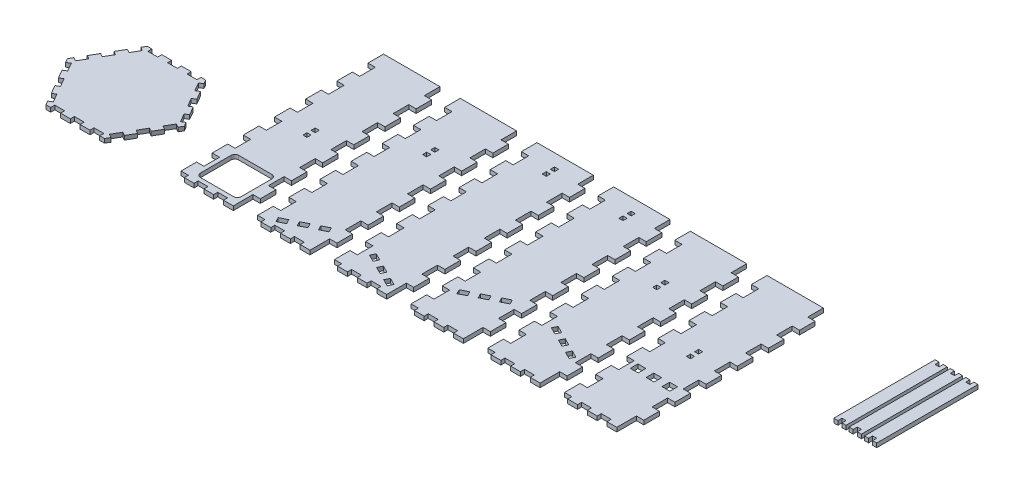
from build123d import *

# Parameters (mm, degrees)
BOSS_EXTRUDE3_DEPTH    = 3.2
SKETCH1_W              = 3.2
SKETCH1_H              = 3.2
BOSS_EXTRUDE3_2_DEPTH  = 3.2
BOSS_EXTRUDE3_3_DEPTH  = 3.2
BOSS_EXTRUDE3_4_DEPTH  = 3.2
BOSS_EXTRUDE3_5_DEPTH  = 3.2
BOSS_EXTRUDE3_6_DEPTH  = 3.2
SKETCH1_W_2            = 6.2
SKETCH1_H_2            = 6
BOSS_EXTRUDE3_7_DEPTH  = 3.2
BOSS_EXTRUDE3_8_DEPTH  = 3.2
BOSS_EXTRUDE3_9_DEPTH  = 3.2
BOSS_EXTRUDE3_10_DEPTH = 3.2


with BuildPart() as part:
    # Sketch1 → Boss-Extrude3 (new body)
    with BuildSketch(Plane(origin=(0, 0, 0), x_dir=(1, 0, 0), z_dir=(0, 1, 0))):
        Polygon((-22.869998863, -39.612), (-19.17495714, -39.612), (-19.17495714, -36.412), (-11.504974284, -36.412), (-11.504974284, -39.612), (-3.834991428, -39.612), (-3.834991428, -36.412), (3.834991428, -36.412), (3.834991428, -39.612), (11.504974284, -39.612), (11.504974284, -36.412), (19.17495714, -36.412), (19.17495714, -39.612), (22.869998863, -39.612), (24.717519725, -36.412), (21.946238432, -34.812), (25.781229861, -28.1696), (28.552511153, -29.7696), (32.387502581, -23.1272), (29.616221289, -21.5272), (33.451212717, -14.8848), (36.222494009, -16.4848), (40.057485437, -9.8424), (37.286204145, -8.2424), (41.121195573, -1.6), (43.892476865, -3.2), (45.739997726, 0), (43.892476865, 3.2), (41.121195573, 1.6), (37.286204145, 8.2424), (40.057485437, 9.8424), (36.222494009, 16.4848), (33.451212717, 14.8848), (29.616221289, 21.5272), (32.387502581, 23.1272), (28.552511153, 29.7696), (25.781229861, 28.1696), (21.946238432, 34.812), (24.717519725, 36.412), (22.869998863, 39.612), (19.17495714, 39.612), (19.17495714, 36.412), (11.504974284, 36.412), (11.504974284, 39.612), (3.834991428, 39.612), (3.834991428, 36.412), (-3.834991428, 36.412), (-3.834991428, 39.612), (-11.504974284, 39.612), (-11.504974284, 36.412), (-19.17495714, 36.412), (-19.17495714, 39.612), (-22.869998863, 39.612), (-24.717519725, 36.412), (-21.946238432, 34.812), (-25.781229861, 28.1696), (-28.552511153, 29.7696), (-32.387502581, 23.1272), (-29.616221289, 21.5272), (-33.451212717, 14.8848), (-36.222494009, 16.4848), (-40.057485437, 9.8424), (-37.286204145, 8.2424), (-41.121195573, 1.6), (-43.892476865, 3.2), (-45.739997726, 0), (-43.892476865, -3.2), (-41.121195573, -1.6), (-37.286204145, -8.2424), (-40.057485437, -9.8424), (-36.222494009, -16.4848), (-33.451212717, -14.8848), (-29.616221289, -21.5272), (-32.387502581, -23.1272), (-28.552511153, -29.7696), (-25.781229861, -28.1696), (-21.946238432, -34.812), (-24.717519725, -36.412), align=None)
    extrude(amount=BOSS_EXTRUDE3_DEPTH)


with BuildPart() as body_2:
    # Sketch1 → Boss-Extrude3 2 (new body)
    with BuildSketch(Plane(origin=(0, 0, 0), x_dir=(1, 0, 0), z_dir=(0, 1, 0))):
        Polygon((80.552757397, -34.879378177), (88.222740254, -34.879378177), (88.222740254, -31.679378177), (95.89272311, -31.679378177), (95.89272311, -34.879378177), (103.562705966, -34.879378177), (103.562705966, -31.679378177), (111.232688822, -31.679378177), (111.232688822, -34.879378177), (118.902671678, -34.879378177), (118.902671678, -19.491070485), (124.645234262, -19.491070485), (124.645234262, -7.302762793), (118.902671678, -7.302762793), (118.902671678, 4.8855449), (124.645234262, 4.8855449), (124.645234262, 17.073852592), (118.902671678, 17.073852592), (118.902671678, 29.262160284), (124.645234262, 29.262160284), (124.645234262, 41.450467977), (118.902671678, 41.450467977), (118.902671678, 53.638775669), (124.645234262, 53.638775669), (124.645234262, 65.827083361), (118.902671678, 65.827083361), (118.902671678, 78.015391054), (124.645234262, 78.015391054), (124.645234262, 90.203698746), (118.902671678, 90.203698746), (118.902671678, 102.392006438), (124.645234262, 102.392006438), (124.645234262, 114.58031413), (118.902671678, 114.58031413), (118.902671678, 126.768621823), (74.810194813, 126.768621823), (74.810194813, 114.58031413), (80.552757397, 114.58031413), (80.552757397, 102.392006438), (74.810194813, 102.392006438), (74.810194813, 90.203698746), (80.552757397, 90.203698746), (80.552757397, 78.015391054), (74.810194813, 78.015391054), (74.810194813, 65.827083361), (80.552757397, 65.827083361), (80.552757397, 53.638775669), (74.810194813, 53.638775669), (74.810194813, 41.450467977), (80.552757397, 41.450467977), (80.552757397, 29.262160284), (74.810194813, 29.262160284), (74.810194813, 17.073852592), (80.552757397, 17.073852592), (80.552757397, 4.8855449), (74.810194813, 4.8855449), (74.810194813, -7.302762793), (80.552757397, -7.302762793), (80.552757397, -19.491070485), (74.810194813, -19.491070485), (74.810194813, -31.679378177), (80.552757397, -31.679378177), align=None)
        with BuildLine():
            Line((86.752757397, 1.520621823), (112.702671678, 1.520621823))
            ThreePointArc((112.702671678, 1.520621823), (114.823992022, 0.641942166), (115.702671678, -1.479378177))
            Line((115.702671678, -1.479378177), (115.702671678, -25.479378177))
            ThreePointArc((115.702671678, -25.479378177), (114.823992022, -27.600698521), (112.702671678, -28.479378177))
            Line((112.702671678, -28.479378177), (86.752757397, -28.479378177))
            ThreePointArc((86.752757397, -28.479378177), (84.631437054, -27.600698521), (83.752757397, -25.479378177))
            Line((83.752757397, -25.479378177), (83.752757397, -1.479378177))
            ThreePointArc((83.752757397, -1.479378177), (84.631437054, 0.641942166), (86.752757397, 1.520621823))
        make_face(mode=Mode.SUBTRACT)
        with Locations((99.727714538, 41.960621823)):
            Rectangle(SKETCH1_W, SKETCH1_H, mode=Mode.SUBTRACT)
        with Locations((99.727714538, 48.360621823)):
            Rectangle(SKETCH1_W, SKETCH1_H, mode=Mode.SUBTRACT)
    extrude(amount=BOSS_EXTRUDE3_2_DEPTH)


with BuildPart() as body_3:
    # Sketch1 → Boss-Extrude3 3 (new body)
    with BuildSketch(Plane(origin=(0, 0, 0), x_dir=(1, 0, 0), z_dir=(0, 1, 0))):
        Polygon((140.552757397, -34.879378177), (148.222740254, -34.879378177), (148.222740254, -31.679378177), (155.89272311, -31.679378177), (155.89272311, -34.879378177), (163.562705966, -34.879378177), (163.562705966, -31.679378177), (171.232688822, -31.679378177), (171.232688822, -34.879378177), (178.902671678, -34.879378177), (178.902671678, -19.491070485), (184.645234262, -19.491070485), (184.645234262, -7.302762793), (178.902671678, -7.302762793), (178.902671678, 4.8855449), (184.645234262, 4.8855449), (184.645234262, 17.073852592), (178.902671678, 17.073852592), (178.902671678, 29.262160284), (184.645234262, 29.262160284), (184.645234262, 41.450467977), (178.902671678, 41.450467977), (178.902671678, 53.638775669), (184.645234262, 53.638775669), (184.645234262, 65.827083361), (178.902671678, 65.827083361), (178.902671678, 78.015391054), (184.645234262, 78.015391054), (184.645234262, 90.203698746), (178.902671678, 90.203698746), (178.902671678, 102.392006438), (184.645234262, 102.392006438), (184.645234262, 114.58031413), (178.902671678, 114.58031413), (178.902671678, 126.768621823), (134.810194813, 126.768621823), (134.810194813, 114.58031413), (140.552757397, 114.58031413), (140.552757397, 102.392006438), (134.810194813, 102.392006438), (134.810194813, 90.203698746), (140.552757397, 90.203698746), (140.552757397, 78.015391054), (134.810194813, 78.015391054), (134.810194813, 65.827083361), (140.552757397, 65.827083361), (140.552757397, 53.638775669), (134.810194813, 53.638775669), (134.810194813, 41.450467977), (140.552757397, 41.450467977), (140.552757397, 29.262160284), (134.810194813, 29.262160284), (134.810194813, 17.073852592), (140.552757397, 17.073852592), (140.552757397, 4.8855449), (134.810194813, 4.8855449), (134.810194813, -7.302762793), (140.552757397, -7.302762793), (140.552757397, -19.491070485), (134.810194813, -19.491070485), (134.810194813, -31.679378177), (140.552757397, -31.679378177), align=None)
        Polygon((144.432637465, -25.240025921), (149.978339593, -22.467808774), (151.766866785, -26.045681115), (146.221164657, -28.817898262), align=None, mode=Mode.SUBTRACT)
        Polygon((155.524041721, -19.695591627), (161.069743848, -16.92337448), (162.85827104, -20.50124682), (157.312568912, -23.273463967), align=None, mode=Mode.SUBTRACT)
        Polygon((166.615445976, -14.151157333), (172.161148104, -11.378940185), (173.949675295, -14.956812526), (168.403973168, -17.729029673), align=None, mode=Mode.SUBTRACT)
        with Locations((159.727714538, 75.560621823)):
            Rectangle(SKETCH1_W, SKETCH1_H, mode=Mode.SUBTRACT)
        with Locations((159.727714538, 81.960621823)):
            Rectangle(SKETCH1_W, SKETCH1_H, mode=Mode.SUBTRACT)
    extrude(amount=BOSS_EXTRUDE3_3_DEPTH)


with BuildPart() as body_4:
    # Sketch1 → Boss-Extrude3 4 (new body)
    with BuildSketch(Plane(origin=(0, 0, 0), x_dir=(1, 0, 0), z_dir=(0, 1, 0))):
        Polygon((200.552757397, -34.879378177), (208.222740254, -34.879378177), (208.222740254, -31.679378177), (215.89272311, -31.679378177), (215.89272311, -34.879378177), (223.562705966, -34.879378177), (223.562705966, -31.679378177), (231.232688822, -31.679378177), (231.232688822, -34.879378177), (238.902671678, -34.879378177), (238.902671678, -19.491070485), (244.645234262, -19.491070485), (244.645234262, -7.302762793), (238.902671678, -7.302762793), (238.902671678, 4.8855449), (244.645234262, 4.8855449), (244.645234262, 17.073852592), (238.902671678, 17.073852592), (238.902671678, 29.262160284), (244.645234262, 29.262160284), (244.645234262, 41.450467977), (238.902671678, 41.450467977), (238.902671678, 53.638775669), (244.645234262, 53.638775669), (244.645234262, 65.827083361), (238.902671678, 65.827083361), (238.902671678, 78.015391054), (244.645234262, 78.015391054), (244.645234262, 90.203698746), (238.902671678, 90.203698746), (238.902671678, 102.392006438), (244.645234262, 102.392006438), (244.645234262, 114.58031413), (238.902671678, 114.58031413), (238.902671678, 126.768621823), (194.810194813, 126.768621823), (194.810194813, 114.58031413), (200.552757397, 114.58031413), (200.552757397, 102.392006438), (194.810194813, 102.392006438), (194.810194813, 90.203698746), (200.552757397, 90.203698746), (200.552757397, 78.015391054), (194.810194813, 78.015391054), (194.810194813, 65.827083361), (200.552757397, 65.827083361), (200.552757397, 53.638775669), (194.810194813, 53.638775669), (194.810194813, 41.450467977), (200.552757397, 41.450467977), (200.552757397, 29.262160284), (194.810194813, 29.262160284), (194.810194813, 17.073852592), (200.552757397, 17.073852592), (200.552757397, 4.8855449), (194.810194813, 4.8855449), (194.810194813, -7.302762793), (200.552757397, -7.302762793), (200.552757397, -19.491070485), (194.810194813, -19.491070485), (194.810194813, -31.679378177), (200.552757397, -31.679378177), align=None)
        Polygon((207.294280972, -11.378940185), (205.50575378, -14.956812526), (211.051455908, -17.729029673), (212.8399831, -14.151157333), align=None, mode=Mode.SUBTRACT)
        Polygon((218.385685227, -16.92337448), (216.597158036, -20.50124682), (222.142860163, -23.273463967), (223.931387355, -19.695591627), align=None, mode=Mode.SUBTRACT)
        Polygon((229.477089483, -22.467808774), (227.688562291, -26.045681115), (233.234264419, -28.817898262), (235.02279161, -25.240025921), align=None, mode=Mode.SUBTRACT)
        with Locations((219.727714538, 109.160621823)):
            Rectangle(SKETCH1_W, SKETCH1_H, mode=Mode.SUBTRACT)
        with Locations((219.727714538, 115.560621823)):
            Rectangle(SKETCH1_W, SKETCH1_H, mode=Mode.SUBTRACT)
    extrude(amount=BOSS_EXTRUDE3_4_DEPTH)


with BuildPart() as body_5:
    # Sketch1 → Boss-Extrude3 5 (new body)
    with BuildSketch(Plane(origin=(0, 0, 0), x_dir=(1, 0, 0), z_dir=(0, 1, 0))):
        Polygon((260.552757397, -34.879378177), (268.222740254, -34.879378177), (268.222740254, -31.679378177), (275.89272311, -31.679378177), (275.89272311, -34.879378177), (283.562705966, -34.879378177), (283.562705966, -31.679378177), (291.232688822, -31.679378177), (291.232688822, -34.879378177), (298.902671678, -34.879378177), (298.902671678, -19.491070485), (304.645234262, -19.491070485), (304.645234262, -7.302762793), (298.902671678, -7.302762793), (298.902671678, 4.8855449), (304.645234262, 4.8855449), (304.645234262, 17.073852592), (298.902671678, 17.073852592), (298.902671678, 29.262160284), (304.645234262, 29.262160284), (304.645234262, 41.450467977), (298.902671678, 41.450467977), (298.902671678, 53.638775669), (304.645234262, 53.638775669), (304.645234262, 65.827083361), (298.902671678, 65.827083361), (298.902671678, 78.015391054), (304.645234262, 78.015391054), (304.645234262, 90.203698746), (298.902671678, 90.203698746), (298.902671678, 102.392006438), (304.645234262, 102.392006438), (304.645234262, 114.58031413), (298.902671678, 114.58031413), (298.902671678, 126.768621823), (254.810194813, 126.768621823), (254.810194813, 114.58031413), (260.552757397, 114.58031413), (260.552757397, 102.392006438), (254.810194813, 102.392006438), (254.810194813, 90.203698746), (260.552757397, 90.203698746), (260.552757397, 78.015391054), (254.810194813, 78.015391054), (254.810194813, 65.827083361), (260.552757397, 65.827083361), (260.552757397, 53.638775669), (254.810194813, 53.638775669), (254.810194813, 41.450467977), (260.552757397, 41.450467977), (260.552757397, 29.262160284), (254.810194813, 29.262160284), (254.810194813, 17.073852592), (260.552757397, 17.073852592), (260.552757397, 4.8855449), (254.810194813, 4.8855449), (254.810194813, -7.302762793), (260.552757397, -7.302762793), (260.552757397, -19.491070485), (254.810194813, -19.491070485), (254.810194813, -31.679378177), (260.552757397, -31.679378177), align=None)
        Polygon((265.863459219, -6.902455299), (264.074932027, -3.324582959), (269.620634155, -0.552365811), (271.409161346, -4.130238152), align=None, mode=Mode.SUBTRACT)
        Polygon((275.166336282, 2.219851336), (276.954863474, -1.358021005), (282.500565602, 1.414196143), (280.71203841, 4.992068483), align=None, mode=Mode.SUBTRACT)
        Polygon((286.257740538, 7.76428563), (288.046267729, 4.18641329), (293.591969857, 6.958630437), (291.803442665, 10.536502777), align=None, mode=Mode.SUBTRACT)
        with Locations((279.727714538, 115.560621823)):
            Rectangle(SKETCH1_W, SKETCH1_H, mode=Mode.SUBTRACT)
        with Locations((279.727714538, 109.160621823)):
            Rectangle(SKETCH1_W, SKETCH1_H, mode=Mode.SUBTRACT)
    extrude(amount=BOSS_EXTRUDE3_5_DEPTH)


with BuildPart() as body_6:
    # Sketch1 → Boss-Extrude3 6 (new body)
    with BuildSketch(Plane(origin=(0, 0, 0), x_dir=(1, 0, 0), z_dir=(0, 1, 0))):
        Polygon((320.552757397, -34.879378177), (328.222740254, -34.879378177), (328.222740254, -31.679378177), (335.89272311, -31.679378177), (335.89272311, -34.879378177), (343.562705966, -34.879378177), (343.562705966, -31.679378177), (351.232688822, -31.679378177), (351.232688822, -34.879378177), (358.902671678, -34.879378177), (358.902671678, -19.491070485), (364.645234262, -19.491070485), (364.645234262, -7.302762793), (358.902671678, -7.302762793), (358.902671678, 4.8855449), (364.645234262, 4.8855449), (364.645234262, 17.073852592), (358.902671678, 17.073852592), (358.902671678, 29.262160284), (364.645234262, 29.262160284), (364.645234262, 41.450467977), (358.902671678, 41.450467977), (358.902671678, 53.638775669), (364.645234262, 53.638775669), (364.645234262, 65.827083361), (358.902671678, 65.827083361), (358.902671678, 78.015391054), (364.645234262, 78.015391054), (364.645234262, 90.203698746), (358.902671678, 90.203698746), (358.902671678, 102.392006438), (364.645234262, 102.392006438), (364.645234262, 114.58031413), (358.902671678, 114.58031413), (358.902671678, 126.768621823), (314.810194813, 126.768621823), (314.810194813, 114.58031413), (320.552757397, 114.58031413), (320.552757397, 102.392006438), (314.810194813, 102.392006438), (314.810194813, 90.203698746), (320.552757397, 90.203698746), (320.552757397, 78.015391054), (314.810194813, 78.015391054), (314.810194813, 65.827083361), (320.552757397, 65.827083361), (320.552757397, 53.638775669), (314.810194813, 53.638775669), (314.810194813, 41.450467977), (320.552757397, 41.450467977), (320.552757397, 29.262160284), (314.810194813, 29.262160284), (314.810194813, 17.073852592), (320.552757397, 17.073852592), (320.552757397, 4.8855449), (314.810194813, 4.8855449), (314.810194813, -7.302762793), (320.552757397, -7.302762793), (320.552757397, -19.491070485), (314.810194813, -19.491070485), (314.810194813, -31.679378177), (320.552757397, -31.679378177), align=None)
        Polygon((327.65198641, 10.536502777), (333.197688538, 7.76428563), (331.409161346, 4.18641329), (325.863459219, 6.958630437), align=None, mode=Mode.SUBTRACT)
        Polygon((338.743390666, 4.992068483), (344.289092793, 2.219851336), (342.500565602, -1.358021005), (336.954863474, 1.414196143), align=None, mode=Mode.SUBTRACT)
        Polygon((348.046267729, -4.130238152), (353.591969857, -6.902455299), (355.380497049, -3.324582959), (349.834794921, -0.552365811), align=None, mode=Mode.SUBTRACT)
        with Locations((339.727714538, 81.960621823)):
            Rectangle(SKETCH1_W, SKETCH1_H, mode=Mode.SUBTRACT)
        with Locations((339.727714538, 75.560621823)):
            Rectangle(SKETCH1_W, SKETCH1_H, mode=Mode.SUBTRACT)
    extrude(amount=BOSS_EXTRUDE3_6_DEPTH)


with BuildPart() as body_7:
    # Sketch1 → Boss-Extrude3 7 (new body)
    with BuildSketch(Plane(origin=(0, 0, 0), x_dir=(1, 0, 0), z_dir=(0, 1, 0))):
        Polygon((380.552757397, -34.879378177), (388.222740254, -34.879378177), (388.222740254, -31.679378177), (395.89272311, -31.679378177), (395.89272311, -34.879378177), (403.562705966, -34.879378177), (403.562705966, -31.679378177), (411.232688822, -31.679378177), (411.232688822, -34.879378177), (418.902671678, -34.879378177), (418.902671678, -19.491070485), (424.645234262, -19.491070485), (424.645234262, -7.302762793), (418.902671678, -7.302762793), (418.902671678, 4.8855449), (424.645234262, 4.8855449), (424.645234262, 17.073852592), (418.902671678, 17.073852592), (418.902671678, 29.262160284), (424.645234262, 29.262160284), (424.645234262, 41.450467977), (418.902671678, 41.450467977), (418.902671678, 53.638775669), (424.645234262, 53.638775669), (424.645234262, 65.827083361), (418.902671678, 65.827083361), (418.902671678, 78.015391054), (424.645234262, 78.015391054), (424.645234262, 90.203698746), (418.902671678, 90.203698746), (418.902671678, 102.392006438), (424.645234262, 102.392006438), (424.645234262, 114.58031413), (418.902671678, 114.58031413), (418.902671678, 126.768621823), (374.810194813, 126.768621823), (374.810194813, 114.58031413), (380.552757397, 114.58031413), (380.552757397, 102.392006438), (374.810194813, 102.392006438), (374.810194813, 90.203698746), (380.552757397, 90.203698746), (380.552757397, 78.015391054), (374.810194813, 78.015391054), (374.810194813, 65.827083361), (380.552757397, 65.827083361), (380.552757397, 53.638775669), (374.810194813, 53.638775669), (374.810194813, 41.450467977), (380.552757397, 41.450467977), (380.552757397, 29.262160284), (374.810194813, 29.262160284), (374.810194813, 17.073852592), (380.552757397, 17.073852592), (380.552757397, 4.8855449), (374.810194813, 4.8855449), (374.810194813, -7.302762793), (380.552757397, -7.302762793), (380.552757397, -19.491070485), (374.810194813, -19.491070485), (374.810194813, -31.679378177), (380.552757397, -31.679378177), align=None)
        with Locations((387.327714538, 13.360621823)):
            Rectangle(SKETCH1_W_2, SKETCH1_H_2, mode=Mode.SUBTRACT)
        with Locations((399.727714538, 13.360621823)):
            Rectangle(SKETCH1_W_2, SKETCH1_H_2, mode=Mode.SUBTRACT)
        with Locations((412.127714538, 13.360621823)):
            Rectangle(SKETCH1_W_2, SKETCH1_H_2, mode=Mode.SUBTRACT)
        with Locations((399.727714538, 48.360621823)):
            Rectangle(SKETCH1_W, SKETCH1_H, mode=Mode.SUBTRACT)
        with Locations((399.727714538, 41.960621823)):
            Rectangle(SKETCH1_W, SKETCH1_H, mode=Mode.SUBTRACT)
    extrude(amount=BOSS_EXTRUDE3_7_DEPTH)


with BuildPart() as body_8:
    # Sketch1 → Boss-Extrude3 8 (new body)
    with BuildSketch(Plane(origin=(0, 0, 0), x_dir=(1, 0, 0), z_dir=(0, 1, 0))):
        Polygon((497.6107333, 135.403791421), (497.6107333, 56.183791421), (500.8107333, 56.183791421), (500.8107333, 59.383791421), (504.0107333, 59.383791421), (504.0107333, 56.183791421), (507.2107333, 56.183791421), (507.2107333, 135.403791421), (504.0107333, 135.403791421), (504.0107333, 132.203791421), (500.8107333, 132.203791421), (500.8107333, 135.403791421), align=None)
    extrude(amount=BOSS_EXTRUDE3_8_DEPTH)


with BuildPart() as body_9:
    # Sketch1 → Boss-Extrude3 9 (new body)
    with BuildSketch(Plane(origin=(0, 0, 0), x_dir=(1, 0, 0), z_dir=(0, 1, 0))):
        Polygon((509.6107333, 135.403791421), (509.6107333, 56.183791421), (512.8107333, 56.183791421), (512.8107333, 59.383791421), (516.0107333, 59.383791421), (516.0107333, 56.183791421), (519.2107333, 56.183791421), (519.2107333, 135.403791421), (516.0107333, 135.403791421), (516.0107333, 132.203791421), (512.8107333, 132.203791421), (512.8107333, 135.403791421), align=None)
    extrude(amount=BOSS_EXTRUDE3_9_DEPTH)


with BuildPart() as body_10:
    # Sketch1 → Boss-Extrude3 10 (new body)
    with BuildSketch(Plane(origin=(0, 0, 0), x_dir=(1, 0, 0), z_dir=(0, 1, 0))):
        Polygon((521.6107333, 135.403791421), (521.6107333, 56.183791421), (524.8107333, 56.183791421), (524.8107333, 59.383791421), (528.0107333, 59.383791421), (528.0107333, 56.183791421), (531.2107333, 56.183791421), (531.2107333, 135.403791421), (528.0107333, 135.403791421), (528.0107333, 132.203791421), (524.8107333, 132.203791421), (524.8107333, 135.403791421), align=None)
    extrude(amount=BOSS_EXTRUDE3_10_DEPTH)


solid = Compound([part.part, body_2.part, body_3.part, body_4.part, body_5.part, body_6.part, body_7.part, body_8.part, body_9.part, body_10.part])
